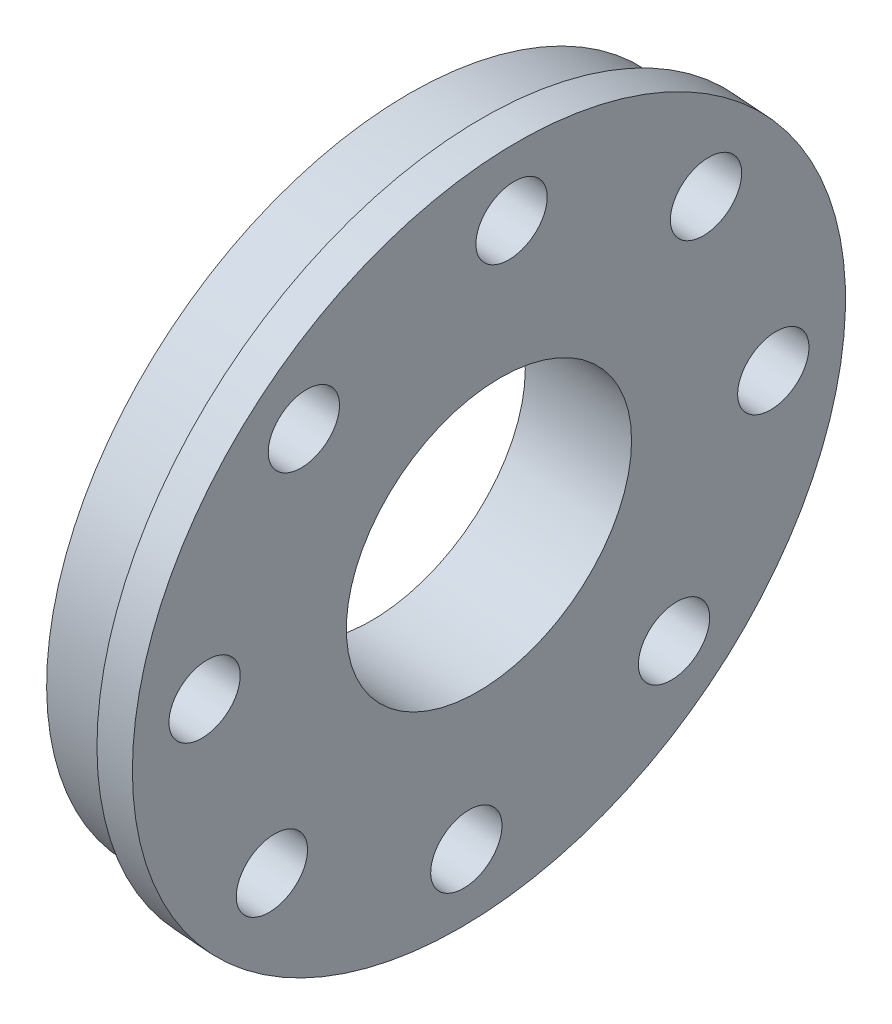
from build123d import *

# Parameters (mm, degrees)
SKETCH1_R           = 14.9606
BOSS_EXTRUDE1_DEPTH = 4.7625
SKETCH2_R           = 6.35
CUT_EXTRUDE1_DEPTH  = 6.35
SKETCH3_R           = 1.5875
CUT_EXTRUDE2_DEPTH  = 10
SKETCH5_R           = 15.875
SKETCH5_R_2         = 14.9606
BOSS_EXTRUDE2_DEPTH = 1.5875


with BuildPart() as part:
    # Sketch1 → Boss-Extrude1 (new body)
    with BuildSketch(Plane(origin=(234.278878836, -18.689027227, 0), x_dir=(0, 0, -1), z_dir=(0.9968332748770866, -0.0795199477981641, 0))):
        with Locations((-43.174261814, 8.550344032)):
            Circle(SKETCH1_R)
    extrude(amount=-BOSS_EXTRUDE1_DEPTH)

    # Sketch2 → Cut-Extrude1 (cut)
    with BuildSketch(Plane(origin=(234.278878836, -18.689027227, 0), x_dir=(0, 0, -1), z_dir=(0.9968332748770866, -0.07951994779816411, 0))):
        with Locations((-43.174261814, 8.550344032)):
            Circle(SKETCH2_R)
    extrude(amount=-CUT_EXTRUDE1_DEPTH, mode=Mode.SUBTRACT)

    # Sketch3 → Cut-Extrude2 (cut)
    with BuildSketch(Plane(origin=(229.531460364, -18.310313476, 0), x_dir=(0, 0, 1), z_dir=(-0.9968332748770866, 0.07951994779816411, 0))):
        with Locations((43.174261814, 21.250344032)):
            Circle(SKETCH3_R)
        with Locations((52.154517935, 17.530600153)):
            Circle(SKETCH3_R)
        with Locations((55.874261814, 8.550344032)):
            Circle(SKETCH3_R)
        with Locations((52.154517935, -0.429912089)):
            Circle(SKETCH3_R)
        with Locations((43.174261814, -4.149655968)):
            Circle(SKETCH3_R)
        with Locations((34.194005693, -0.429912089)):
            Circle(SKETCH3_R)
        with Locations((30.474261814, 8.550344032)):
            Circle(SKETCH3_R)
        with Locations((34.194005693, 17.530600153)):
            Circle(SKETCH3_R)
    extrude(amount=-CUT_EXTRUDE2_DEPTH, mode=Mode.SUBTRACT)

    # Sketch5 → Boss-Extrude2 (add)
    with BuildSketch(Plane(origin=(234.278878836, -18.689027227, 0), x_dir=(0, 0, 1), z_dir=(-0.9968332748770866, 0.07951994779816411, 0))):
        with Locations((43.174261814, 8.550344032)):
            Circle(SKETCH5_R)
        with Locations((43.174261814, 8.550344032)):
            Circle(SKETCH5_R_2, mode=Mode.SUBTRACT)
    extrude(amount=BOSS_EXTRUDE2_DEPTH)


solid = part.part
